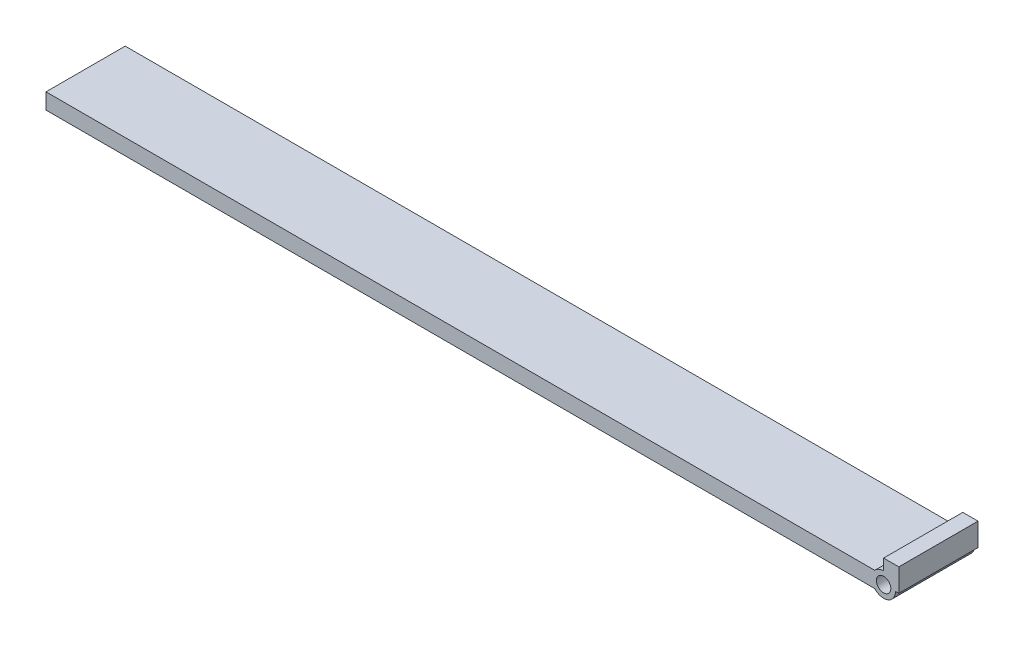
from build123d import *

# Parameters (mm, degrees)
SKETCH1_W      = 528.8
SKETCH1_H      = 50
EXTRUDE2_DEPTH = 10
SKETCH2_R      = 7.5
EXTRUDE3_DEPTH = 50
SKETCH3_W      = 9.599831793
SKETCH3_H      = 14.484799928
EXTRUDE4_DEPTH = 50
SKETCH5_R      = 4.55017582
EXTRUDE5_DEPTH = 50


with BuildPart() as part:
    # Sketch1 → Extrude2 (new body)
    with BuildSketch(Plane(origin=(0, 0, 0), x_dir=(1, 0, 0), z_dir=(0, 1, 0))):
        Rectangle(SKETCH1_W, SKETCH1_H)
    extrude(amount=EXTRUDE2_DEPTH)

    # Sketch2 → Extrude3 (add)
    with BuildSketch(Plane.XY.offset(25)):
        with Locations((264.4, 5)):
            Circle(SKETCH2_R)
    extrude(amount=-EXTRUDE3_DEPTH)

    # Sketch3 → Extrude4 (add)
    with BuildSketch(Plane.XY.offset(25)):
        with Locations((269.199915896, 12.242399964)):
            Rectangle(SKETCH3_W, SKETCH3_H)
    extrude(amount=-EXTRUDE4_DEPTH)

    # Sketch5 → Extrude5 (cut)
    with BuildSketch(Plane.XY.offset(25)):
        with Locations((264.4, 5)):
            Circle(SKETCH5_R)
    extrude(amount=-EXTRUDE5_DEPTH, mode=Mode.SUBTRACT)


solid = part.part
